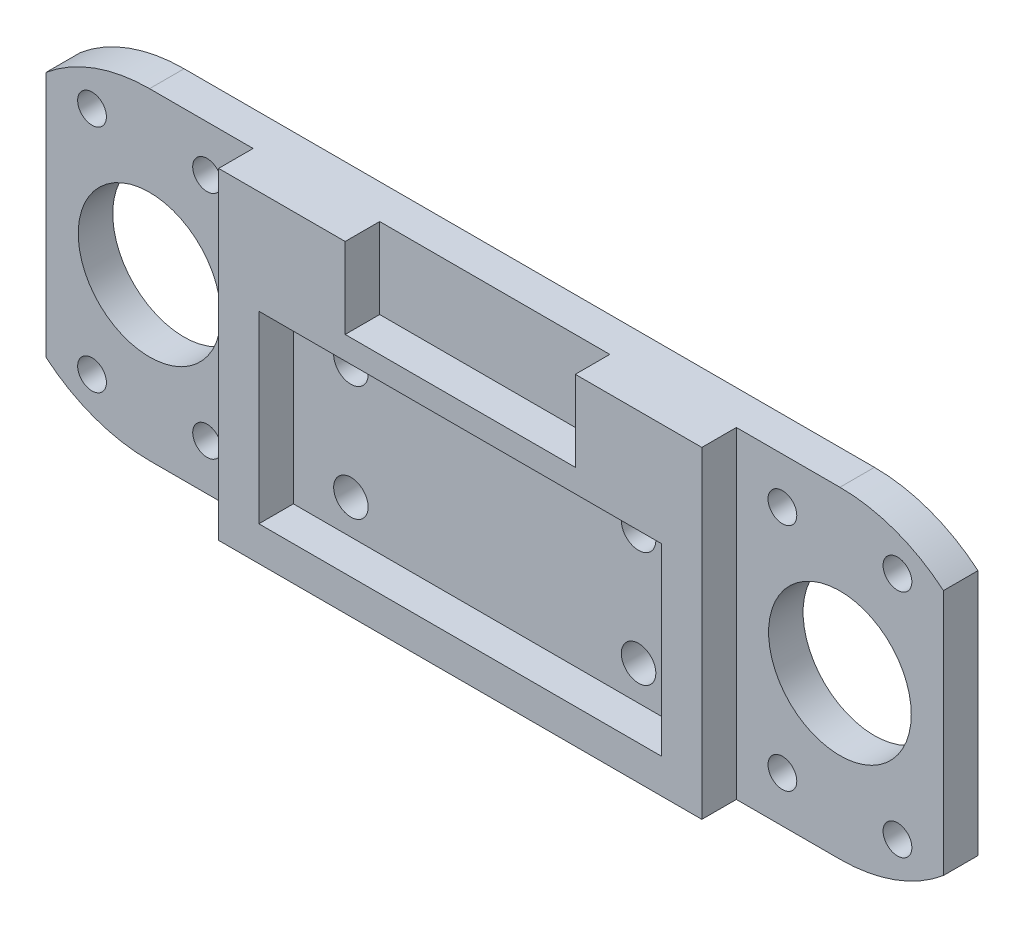
from build123d import *

# Parameters (mm, degrees)
SKETCH1_R              = 6.2
SKETCH1_R_2            = 1.25
MAIN_DEPTH             = 1.5
SKETCH2_W              = 35
SKETCH2_H              = 16
FRAMEWORK_DEPTH        = 3
SKETCH3_R              = 1.5
FIXHOLE_DEPTH          = 42.868842831
HOLEPATTERN_COUNT      = 2
HOLEPATTERN_PITCH      = 25
HOLEPATTERN_COUNT_DIR2 = 2
HOLEPATTERN_PITCH_DIR2 = 10


with BuildPart() as part:
    # Sketch1 → Main (new, symmetric)
    with BuildSketch(Plane.XY):
        with BuildLine():
            Line((-39, 10.723805295), (-39, -10.723805295))
            ThreePointArc((-39, -10.723805295), (-34.78887909, -13.155479355), (-30, -14))
            Line((-30, -14), (30, -14))
            ThreePointArc((30, -14), (34.78887909, -13.155479355), (39, -10.723805295))
            Line((39, -10.723805295), (39, 10.723805295))
            ThreePointArc((39, 10.723805295), (34.78887909, 13.155479355), (30, 14))
            Line((30, 14), (-30, 14))
            ThreePointArc((-30, 14), (-34.78887909, 13.155479355), (-39, 10.723805295))
        make_face()
        with Locations((-30, 0)):
            Circle(SKETCH1_R, mode=Mode.SUBTRACT)
        with Locations((-35, 10)):
            Circle(SKETCH1_R_2, mode=Mode.SUBTRACT)
        with Locations((-25, 10)):
            Circle(SKETCH1_R_2, mode=Mode.SUBTRACT)
        with Locations((-35, -10)):
            Circle(SKETCH1_R_2, mode=Mode.SUBTRACT)
        with Locations((-25, -10)):
            Circle(SKETCH1_R_2, mode=Mode.SUBTRACT)
        with Locations((30, 0)):
            Circle(SKETCH1_R, mode=Mode.SUBTRACT)
        with Locations((25, 10)):
            Circle(SKETCH1_R_2, mode=Mode.SUBTRACT)
        with Locations((35, 10)):
            Circle(SKETCH1_R_2, mode=Mode.SUBTRACT)
        with Locations((25, -10)):
            Circle(SKETCH1_R_2, mode=Mode.SUBTRACT)
        with Locations((35, -10)):
            Circle(SKETCH1_R_2, mode=Mode.SUBTRACT)
    extrude(amount=MAIN_DEPTH, both=True)

    # Sketch2 → Framework (add)
    with BuildSketch(Plane(origin=(0, 0, 1.5), x_dir=(-1, 0, 0), z_dir=(0, 0, -1))):
        Polygon((21, 14), (10, 14), (10, 7), (-10, 7), (-10, 14), (-21, 14), (-21, -14), (21, -14), align=None)
        with Locations((0, -3)):
            Rectangle(SKETCH2_W, SKETCH2_H, mode=Mode.SUBTRACT)
    extrude(amount=-FRAMEWORK_DEPTH)

    # Sketch3 → FixHole (cut, through all)
    with BuildSketch(Plane(origin=(0, 0, -1.5), x_dir=(-1, 0, 0), z_dir=(0, 0, -1))):
        with Locations((12.5, -8)):
            Circle(SKETCH3_R)
    fixhole = extrude(amount=-FIXHOLE_DEPTH, mode=Mode.SUBTRACT)

    # HolePattern: FixHole 2 × 2
    with Locations(*[(i * HOLEPATTERN_PITCH, j * HOLEPATTERN_PITCH_DIR2, 0) for i in range(HOLEPATTERN_COUNT) for j in range(HOLEPATTERN_COUNT_DIR2) if (i, j) != (0, 0)]):
        add(fixhole, mode=Mode.SUBTRACT)


solid = part.part
